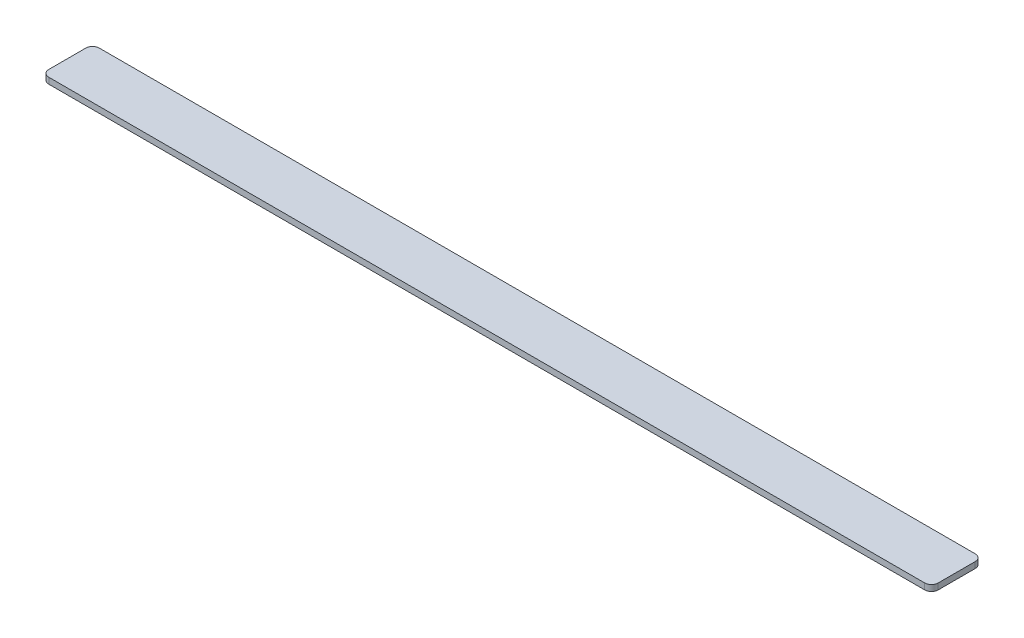
from build123d import *

# Parameters (mm, degrees)
SKETCH1_W          = 335.44584549
SKETCH1_H          = 19.05
BASE_FLANGE1_DEPTH = 2.286
FILLET1_R          = 2.54


# Sheet-metal steps are written as plain solids
with BuildPart() as part:
    # Sketch1 → Base-Flange1 (new body)
    with BuildSketch(Plane(origin=(0, 0, 0), x_dir=(1, 0, 0), z_dir=(0, 1, 0))):
        Rectangle(SKETCH1_W, SKETCH1_H)
    extrude(amount=-BASE_FLANGE1_DEPTH)

    # Fillet1
    fillet1_edges = [part.edges().sort_by_distance(p)[0] for p in [
        (167.722922745, -1.143, 9.525),
        (-167.722922745, -1.143, 9.525),
        (-167.722922745, -1.143, -9.525),
        (167.722922745, -1.143, -9.525),
    ]]
    fillet(fillet1_edges, radius=FILLET1_R)


solid = part.part
